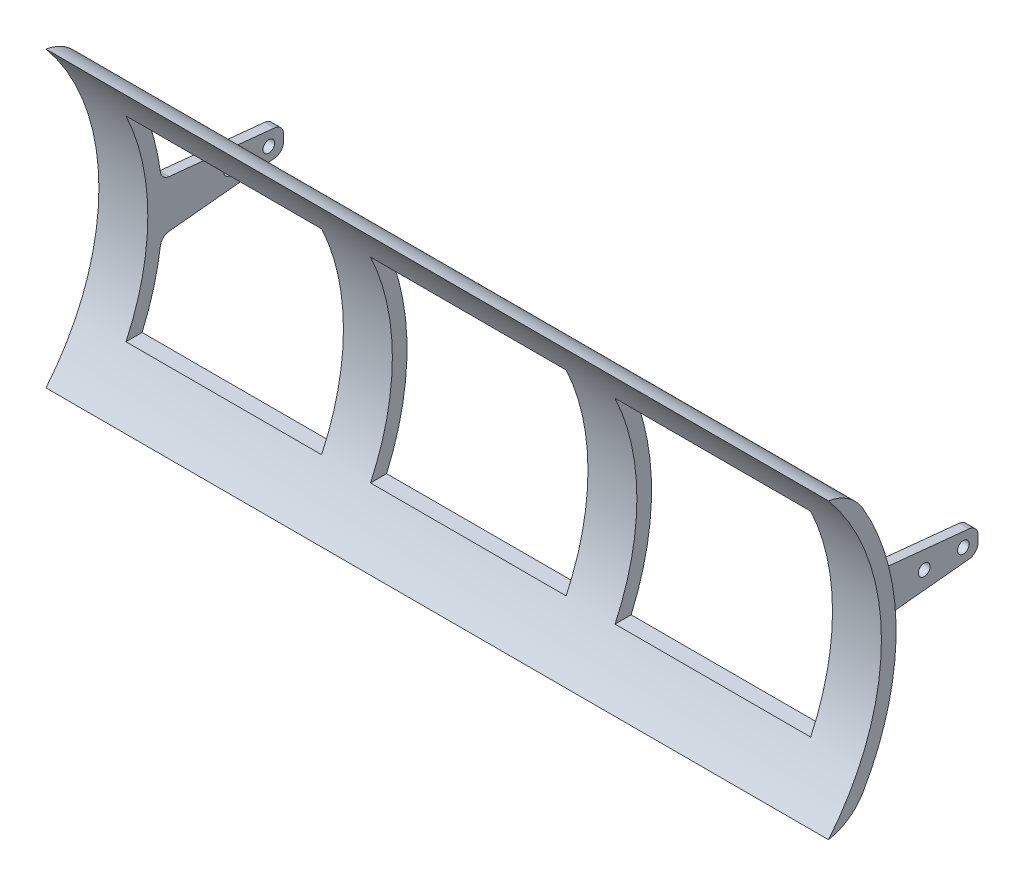
from build123d import *

# Parameters (mm, degrees)
BOSS_EXTRUDE1_DEPTH = 101.6
SKETCH2_W           = 50.8
SKETCH2_H           = 50.8
CUT_EXTRUDE1_DEPTH  = 126.723585695
FILLET1_R           = 12.7
BOSS_EXTRUDE4_START = -2.54
SKETCH6_R           = 1.524
BOSS_EXTRUDE4_DEPTH = 2.54
FILLET4_R           = 2.54


with BuildPart() as part:
    # Sketch1 → Boss-Extrude1 (new, symmetric)
    with BuildSketch(Plane(origin=(0, 0, 0), x_dir=(0, 0, -1), z_dir=(1, 0, 0))):
        with BuildLine():
            Line((50.8, -38.1), (45.948733388, -38.1))
            ThreePointArc((45.948733388, -38.1), (59.69, 0), (45.948733388, 38.1))
            Line((45.948733388, 38.1), (50.8, 38.1))
            ThreePointArc((50.8, 38.1), (63.5, 0), (50.8, -38.1))
        make_face()
    extrude(amount=BOSS_EXTRUDE1_DEPTH, both=True)

    # Sketch2 → Cut-Extrude1 (cut, through all)
    with BuildSketch(Plane.XY):
        with Locations((-63.5, 0)):
            Rectangle(SKETCH2_W, SKETCH2_H)
        with Locations((63.5, 0)):
            Rectangle(SKETCH2_W, SKETCH2_H)
        Rectangle(SKETCH2_W, SKETCH2_H)
    extrude(amount=-CUT_EXTRUDE1_DEPTH, mode=Mode.SUBTRACT)

    # Fillet1
    # the kernel refuses this fillet: 12.7 mm, written as the material it takes off along each edge
    with BuildSketch(Plane(origin=(-120.021720302, 38.1, -50.8), x_dir=(0, -0.8334649822738217, -0.5525722788226877), z_dir=(1, 0, 0))) as fillet1_piece_1:
        with BuildLine():
            CenterArc((6.631819309, -12.678604985), FILLET1_R, 86.673763994, 50.487243594)
            Line((-2.680675447, -4.04336084), (-2.866925342, -3.870655958))
            ThreePointArc((-2.866925342, -3.870655958), (-1.552037829, -1.881327061), (-0.211700105, 0.140353359))
            Line((-0.211700105, 0.140353359), (-0.014737376, 0.2535721))
            ThreePointArc((-0.014737376, 0.2535721), (3.68434406, 0.360975077), (7.383425497, 0.2535721))
            Line((7.383425497, 0.2535721), (7.368688121, 0))
        make_face()
    extrude(amount=240.043440604, mode=Mode.SUBTRACT)
    with BuildSketch(Plane(origin=(-120.021720302, -38.1, -50.8), x_dir=(0, 0, 1), z_dir=(1, 0, 0))) as fillet1_piece_2:
        with BuildLine():
            CenterArc((6.90261377, -12.533234811), FILLET1_R, 99.295330772, 50.487243594)
            Line((-4.071732787, -6.141543514), (-4.291219718, -6.013709688))
            ThreePointArc((-4.291219718, -6.013709688), (-2.33672648, -2.871306936), (-0.2032, 0.1524))
            Line((-0.2032, 0.1524), (0, 0.254))
            ThreePointArc((0, 0.254), (2.425633306, 0.254), (4.810239668, 0.250664696))
            Line((4.810239668, 0.250664696), (4.851266612, 0))
        make_face()
    extrude(amount=240.043440604, mode=Mode.SUBTRACT)

    # Sketch6 → Boss-Extrude4 (add)
    with BuildSketch(Plane.ZY.offset(-88.9).offset(BOSS_EXTRUDE4_START)):
        with BuildLine():
            Line((-63.181702256, -6.35), (-94.931702256, -3.175))
            Line((-94.931702256, -3.175), (-94.931702256, 3.175))
            Line((-94.931702256, 3.175), (-63.181702256, 6.35))
            ThreePointArc((-63.181702256, 6.35), (-63.5, 0), (-63.181702256, -6.35))
        make_face()
        with Locations((-91.121702256, 0)):
            Circle(SKETCH6_R, mode=Mode.SUBTRACT)
        with Locations((-80.961702256, 0)):
            Circle(SKETCH6_R, mode=Mode.SUBTRACT)
    boss_extrude4 = extrude(amount=BOSS_EXTRUDE4_DEPTH)

    # Mirror2: Boss-Extrude4 across plane
    add(boss_extrude4.mirror(Plane(origin=(0, 0, 0), x_dir=(0, 0, 1), z_dir=(1, 0, 0))))

    # Fillet4
    fillet4_edges = [part.edges().sort_by_distance(p)[0] for p in [
        (90.17, 6.35, -63.181702256),
        (90.17, -6.35, -63.181702256),
        (90.17, -3.175, -94.931702256),
        (90.17, 3.175, -94.931702256),
        (-91.44, 0, -63.5),
        (-90.17, -6.35, -63.181702256),
        (-90.17, 6.35, -63.181702256),
        (-90.17, 3.175, -94.931702256),
        (-90.17, -3.175, -94.931702256),
        (91.44, 0, -63.5),
    ]]
    fillet(fillet4_edges, radius=FILLET4_R)


solid = part.part
